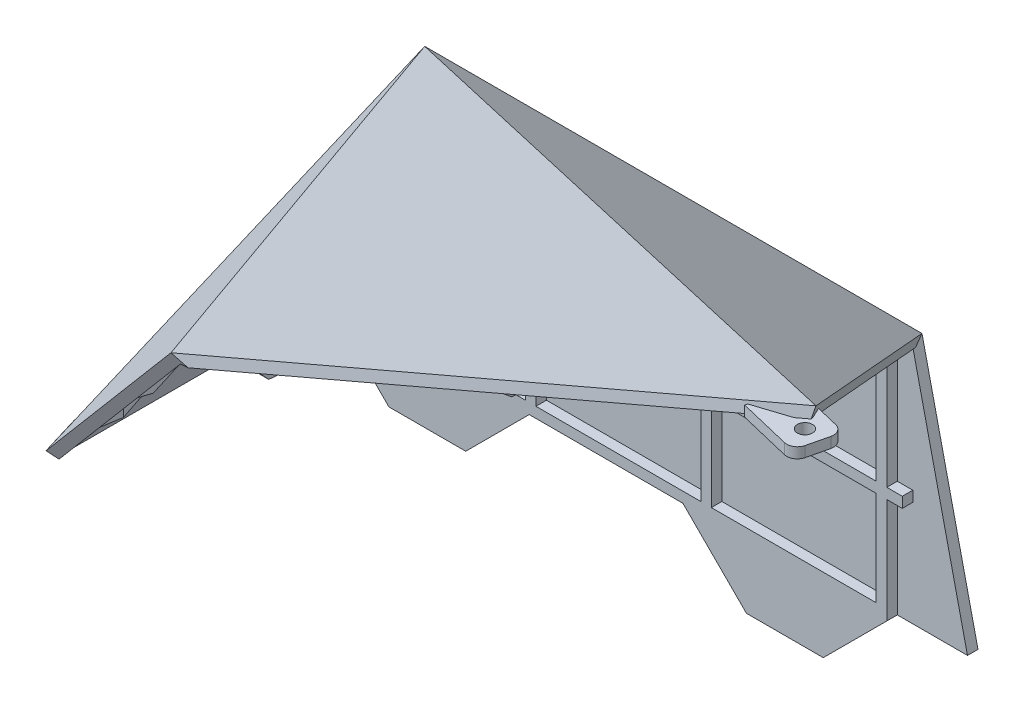
from build123d import *

# Parameters (mm, degrees)
EXTRUDE1_DEPTH  = 3
EXTRUDE2_DEPTH  = 3
EXTRUDE4_DEPTH  = 3
EXTRUDE5_DEPTH  = 3
EXTRUDE6_DEPTH  = 3
SKETCH10_W      = 112.57156026
SKETCH10_H      = 90.15603265
EXTRUDE7_DEPTH  = 3
SKETCH11_W      = 73.757764298
SKETCH11_H      = 14.759555355
EXTRUDE8_DEPTH  = 3
SKETCH12_W      = 167.871510219
SKETCH12_H      = 195.865171009
EXTRUDE10_DEPTH = 3
SKETCH13_W      = 44.568245146
SKETCH13_H      = 24.512134406
EXTRUDE11_DEPTH = 3
SKETCH14_W      = 60.210030943
SKETCH14_H      = 16.018184112
EXTRUDE12_DEPTH = 3
SKETCH15_W      = 14.88927725
SKETCH15_H      = 13.487454676
EXTRUDE13_DEPTH = 3
EXTRUDE14_DEPTH = 3
EXTRUDE15_DEPTH = 3
EXTRUDE16_DEPTH = 3
SKETCH19_W      = 21.1
SKETCH19_H      = 21.1
SKETCH19_W_2    = 15.1
SKETCH19_H_2    = 15.1
EXTRUDE17_DEPTH = 160
EXTRUDE18_DEPTH = 160
SKETCH21_R      = 1.7
EXTRUDE19_DEPTH = 10
EXTRUDE20_DEPTH = 3
EXTRUDE21_DEPTH = 3
FILLET1_R       = 3
SKETCH26_R      = 2.15
EXTRUDE25_DEPTH = 3


with BuildPart() as part:
    # Sketch1 → Extrude1 (new body)
    with BuildSketch(Plane.XY):
        Polygon((-295, -10), (-113.158578494, -10), (-129.119149358, 60), (-270.857265661, 60), align=None)
    extrude(amount=-EXTRUDE1_DEPTH)

    # Sketch2 → Extrude2 (add)
    with BuildSketch(Plane(origin=(-260.556909704, 89.865089302, 0), x_dir=(0, 0, 1), z_dir=(-0.9453529883919826, 0.32604865793060395, 0))):
        Polygon((0, -31.591468656), (0, -105.637883973), (80.787415456, -105.637883973), align=None)
    extrude(amount=-EXTRUDE2_DEPTH)

    # Sketch7 → Extrude4 (add)
    with BuildSketch(Plane(origin=(0, 43.724883183, -28.218487637), x_dir=(1, 0, 0), z_dir=(0, 0.8402188568223107, -0.542247427509075))):
        Polygon((-66.361624075, -140.664783174), (-129.119149358, -30.01418908), (-270.857265661, -30.01418908), align=None)
    extrude(amount=-EXTRUDE4_DEPTH)

    # Sketch8 → Extrude5 (add)
    with BuildSketch(Plane(origin=(-189.080060989, 140.522185804, 62.916886699), x_dir=(0.2140152692749169, -0.14457660878331993, 0.9660719790522337), z_dir=(-0.7754375632006807, 0.5762965209858841, 0.25802888496630927))):
        Polygon((77.973632782, -48.795912254), (-69.54040311, -112.607734629), (16.357719984, -184.194849804), align=None)
    extrude(amount=-EXTRUDE5_DEPTH)

    # Sketch9 → Extrude6 (add)
    with BuildSketch(Plane(origin=(-30.531564034, 120.326118689, -10.497879236), x_dir=(0.9695050365136778, 0.24414396845566366, -0.021300395332766054), z_dir=(-0.24507138587483487, 0.9658361632356843, -0.08426459287007951))):
        Polygon((-36.95706437, -100.060049534), (-176.221988163, -146.089942976), (-247.884943942, -2.226256699), align=None)
    extrude(amount=-EXTRUDE6_DEPTH)

    # Sketch10 → Extrude7 (cut)
    with BuildSketch(Plane(origin=(-189.080060989, 140.522185804, 62.916886699), x_dir=(0.21239781363418442, -0.14676505830068742, 0.9660989527089936), z_dir=(-0.7754375632006807, 0.5762965209858839, 0.2580288849663094))):
        with Locations((-39.401841305, -133.616606124)):
            Rectangle(SKETCH10_W, SKETCH10_H)
    extrude(amount=EXTRUDE7_DEPTH, mode=Mode.SUBTRACT)

    # Sketch11 → Extrude8 (cut)
    with BuildSketch(Plane(origin=(0, 0, -3), x_dir=(-1, 0, 0), z_dir=(0, 0, -1))):
        with Locations((276.218608966, 62.807931157)):
            Rectangle(SKETCH11_W, SKETCH11_H)
    extrude(amount=EXTRUDE8_DEPTH, mode=Mode.SUBTRACT)

    # Sketch12 → Extrude10 (cut)
    with BuildSketch(Plane.XZ.offset(10)):
        with Locations((-271.948656963, 73.44943118)):
            Rectangle(SKETCH12_W, SKETCH12_H)
    extrude(amount=EXTRUDE10_DEPTH, mode=Mode.SUBTRACT)

    # Sketch13 → Extrude11 (cut)
    with BuildSketch(Plane(origin=(-4.673982312, -42.376918928, 80.600625378), x_dir=(0.998673903463446, -0.028089978665127358, 0.04314380186859445), z_dir=(-0.0512600678591273, -0.46475223799649945, 0.8839557470373293))):
        with Locations((-195.528663134, 143.517199712)):
            Rectangle(SKETCH13_W, SKETCH13_H)
    extrude(amount=EXTRUDE11_DEPTH, mode=Mode.SUBTRACT)

    # Sketch14 → Extrude12 (cut)
    with BuildSketch(Plane(origin=(25.376884403, 13.273606688, 78.336355767), x_dir=(0.9525912760030386, -0.050829244506107804, -0.29997708043422433), z_dir=(0.3042529554218049, 0.15914223352478768, 0.9392038589283156))):
        with Locations((-92.868466648, 100.970417501)):
            Rectangle(SKETCH14_W, SKETCH14_H)
    extrude(amount=EXTRUDE12_DEPTH, mode=Mode.SUBTRACT)

    # Sketch15 → Extrude13 (cut)
    with BuildSketch(Plane(origin=(-110.5730929, 34.006271488, 52.693123295), x_dir=(-0.39620203994830133, 0.12185020587824674, -0.910042015990599), z_dir=(0.8698349100305544, -0.2675139251709543, -0.41451601794353676))):
        with Locations((-37.910748446, 93.865777742)):
            Rectangle(SKETCH15_W, SKETCH15_H)
    extrude(amount=EXTRUDE13_DEPTH, mode=Mode.SUBTRACT)

    # Sketch16 → Extrude14 (add)
    with BuildSketch(Plane(origin=(-133.158578494, 0, 0), x_dir=(0, 0, 1), z_dir=(1, 0, 0))):
        Polygon((0, 10), (3, 10), (3, -56.395432616), (61.335859959, -94.61135342), (109.883721877, -98.764116977), (113.96801517, -102.124441221), (60.325493152, -97.535882596), (0, -58.016549713), align=None)
    extrude(amount=-EXTRUDE14_DEPTH)

    # Sketch17 → Extrude15 (add)
    with BuildSketch(Plane(origin=(-183.158578494, 0, 0), x_dir=(0, 0, 1), z_dir=(1, 0, 0))):
        Polygon((0, 10), (3, 10), (3, -56.793961273), (38.693257316, -79.830865525), (129.133738662, -87.695361445), (132.245426698, -90.977267768), (37.691823011, -82.755104205), (0, -58.428299002), align=None)
    extrude(amount=-EXTRUDE15_DEPTH)

    # Sketch18 → Extrude16 (add)
    with BuildSketch(Plane(origin=(-233.158578494, 0, 0), x_dir=(0, 0, 1), z_dir=(1, 0, 0))):
        Polygon((0, 10), (3, 10), (3, -56.770522722), (15.975344392, -65.159870449), (69.550416826, -69.818919628), (112.052632614, -50.780370016), (116.778618158, -51.950628843), (70.06622047, -72.875097941), (14.972618694, -68.083992891), (0, -58.403286097), align=None)
    extrude(amount=-EXTRUDE16_DEPTH)

    # Sketch19 → Extrude17 (add)
    with BuildSketch(Plane(origin=(-133.158578494, 0, 0), x_dir=(0, 0, -1), z_dir=(1, 0, 0))):
        with Locations((7.55, -17.55)):
            Rectangle(SKETCH19_W, SKETCH19_H)
        with Locations((7.55, -17.55)):
            Rectangle(SKETCH19_W_2, SKETCH19_H_2, mode=Mode.SUBTRACT)
    extrude(amount=-EXTRUDE17_DEPTH)

    # Sketch20 → Extrude18 (cut)
    with BuildSketch(Plane(origin=(0, 0, -18.1), x_dir=(-1, 0, 0), z_dir=(0, 0, -1))):
        Polygon((173.158578494, -28.1), (191.258578494, -10), (235.058578494, -10), (253.158578494, -28.1), align=None)
        Polygon((133.158578494, -10), (151.258578494, -28.1), (133.158578494, -28.1), align=None)
        Polygon((293.158578494, -10), (275.058578494, -28.1), (293.158578494, -28.1), align=None)
    extrude(amount=-EXTRUDE18_DEPTH, mode=Mode.SUBTRACT)

    # Sketch21 → Extrude19 (cut)
    with BuildSketch(Plane.XZ.offset(28.1)):
        with Locations((-264.108578494, -7.55)):
            Circle(SKETCH21_R)
        with Locations((-162.208578494, -7.55)):
            Circle(SKETCH21_R)
    extrude(amount=-EXTRUDE19_DEPTH, mode=Mode.SUBTRACT)

    # Sketch22 → Extrude20 (add)
    with BuildSketch(Plane(origin=(0, 20, 0), x_dir=(-1, 0, 0), z_dir=(0, -1, 0))):
        Polygon((128.746491739, 0), (128.746491739, -3), (278.501913599, -3), (278.501913599, -43.066625155), (262.173818801, -91.53270634), (263.2164436, -97.834478028), (281.501913599, -43.558392272), (281.501913599, 0), align=None)
    extrude(amount=-EXTRUDE20_DEPTH)

    # Sketch23 → Extrude21 (add)
    with BuildSketch(Plane(origin=(0, 113, 0), x_dir=(-1, 0, 0), z_dir=(0, -1, 0))):
        Polygon((77.902795881, -84.192634499), (80.727379731, -95.932513111), (62.824583851, -100.239878612), (60, -88.5), align=None)
    extrude(amount=-EXTRUDE21_DEPTH)

    # Fillet1
    fillet1_edges = [part.edges().sort_by_distance(p)[0] for p in [
        (-62.824583851, 114.5, 100.239878612),
        (-60, 114.5, 88.5),
    ]]
    fillet(fillet1_edges, radius=FILLET1_R)

    # Sketch26 → Extrude25 (cut)
    with BuildSketch(Plane(origin=(0, 116, 0), x_dir=(1, 0, 0), z_dir=(0, 1, 0))):
        with Locations((-66.273568669, -93.200328935)):
            Circle(SKETCH26_R)
    extrude(amount=-EXTRUDE25_DEPTH, mode=Mode.SUBTRACT)


solid = part.part
